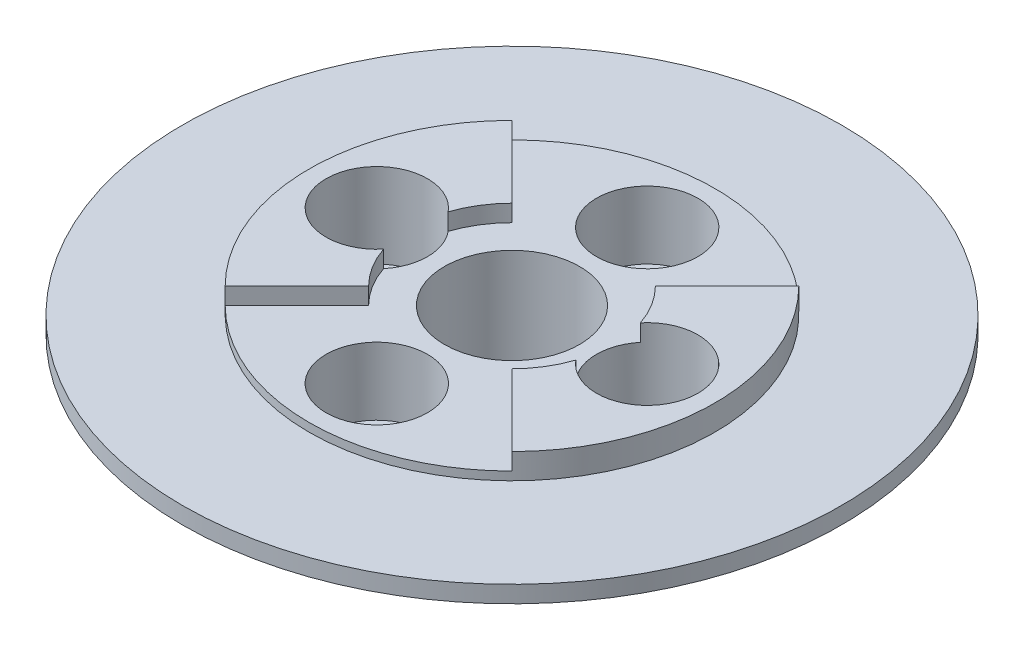
from build123d import *

# Parameters (mm, degrees)
SZKIC3_R                   = 1.5
WYTNIJ_WYCI_GNI_CIE1_DEPTH = 29.451713481
SZKIC4_R                   = 3
WYTNIJ_WYCI_GNI_CIE2_DEPTH = 5
SZYK_KO_OWY1_COUNT         = 4
WYTNIJ_WYCI_GNI_CIE3_START = -1
WYTNIJ_WYCI_GNI_CIE3_DEPTH = 1


with BuildPart() as part:
    # Szkic1 → Obrót1 (revolve)
    with BuildSketch(Plane.XY):
        Polygon((12, 0), (12.5, 0.5), (12.5, 4), (15, 4), (15, 4.5), (19.5, 4.5), (19.5, 5.5), (12, 5.5), (12, 7), (6, 7), (6, 6), (4, 6), (4, 0), align=None)
    revolve(axis=Axis((0, 6, 0), (0, -1, 0)))

    # Szkic3 → Wytnij-wyciągnięcie1 (cut, through all)
    with BuildSketch(Plane(origin=(0, 7, 0), x_dir=(1, 0, 0), z_dir=(0, 1, 0))):
        with Locations((0, -8)):
            Circle(SZKIC3_R)
    wytnij_wyci_gni_cie1 = extrude(amount=-WYTNIJ_WYCI_GNI_CIE1_DEPTH, mode=Mode.SUBTRACT)

    # Szkic4 → Wytnij-wyciągnięcie2 (cut)
    with BuildSketch(Plane(origin=(0, 7, 0), x_dir=(1, 0, 0), z_dir=(0, 1, 0))):
        with Locations((0, -8)):
            Circle(SZKIC4_R)
    wytnij_wyci_gni_cie2 = extrude(amount=-WYTNIJ_WYCI_GNI_CIE2_DEPTH, mode=Mode.SUBTRACT)

    # Szyk kołowy1: Wytnij-wyciągnięcie1, Wytnij-wyciągnięcie2 ×4 about axis
    szyk_ko_owy1_axis = Axis((0, 6, 0), (0, 1, 0))
    add([wytnij_wyci_gni_cie1.rotate(szyk_ko_owy1_axis, i * 360 / SZYK_KO_OWY1_COUNT) for i in range(1, SZYK_KO_OWY1_COUNT)], mode=Mode.SUBTRACT)
    add([wytnij_wyci_gni_cie2.rotate(szyk_ko_owy1_axis, i * 360 / SZYK_KO_OWY1_COUNT) for i in range(1, SZYK_KO_OWY1_COUNT)], mode=Mode.SUBTRACT)

    # Szkic5 → Wytnij-wyciągnięcie3 (cut)
    with BuildSketch(Plane(origin=(0, 7, 0), x_dir=(1, 0, 0), z_dir=(0, 1, 0)).offset(WYTNIJ_WYCI_GNI_CIE3_START)):
        with BuildLine():
            Line((-8.485281374, -8.485281374), (-4.242640687, -4.242640687))
            ThreePointArc((-4.242640687, -4.242640687), (0, -6), (4.242640687, -4.242640687))
            Line((4.242640687, -4.242640687), (8.485281374, -8.485281374))
            ThreePointArc((8.485281374, -8.485281374), (0, -12), (-8.485281374, -8.485281374))
        make_face()
        with BuildLine():
            Line((4.242640687, 4.242640687), (8.485281374, 8.485281374))
            ThreePointArc((8.485281374, 8.485281374), (0, 12), (-8.485281374, 8.485281374))
            Line((-8.485281374, 8.485281374), (-4.242640687, 4.242640687))
            ThreePointArc((-4.242640687, 4.242640687), (0, 6), (4.242640687, 4.242640687))
        make_face()
    extrude(amount=WYTNIJ_WYCI_GNI_CIE3_DEPTH, mode=Mode.SUBTRACT)


solid = part.part
